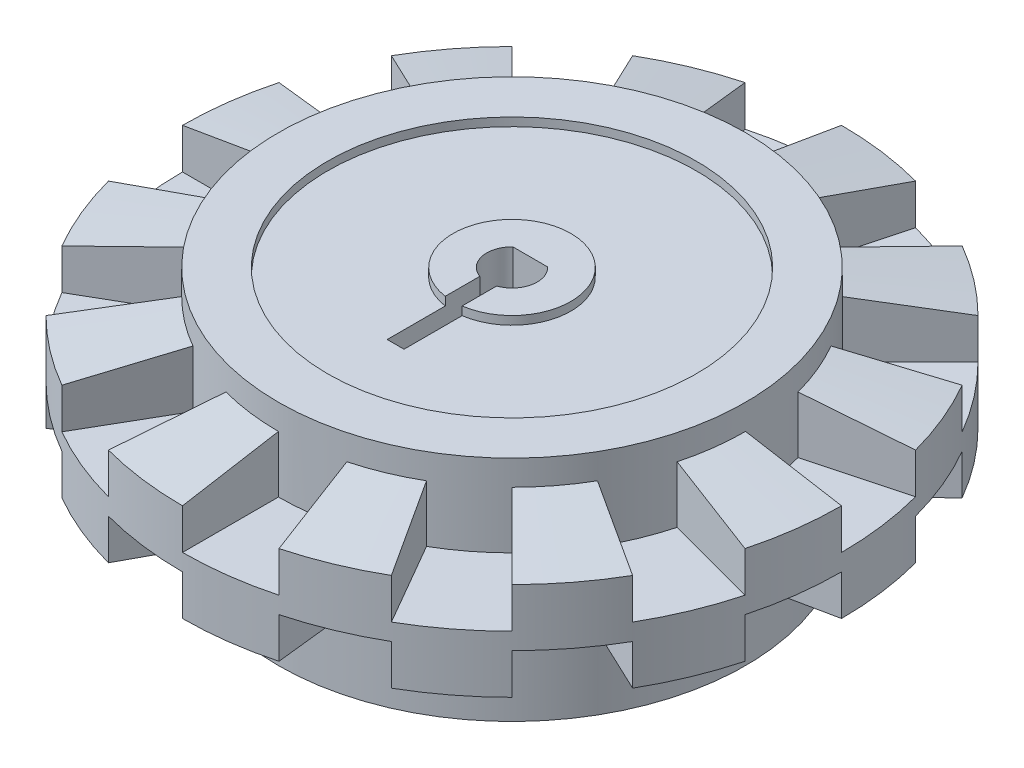
from build123d import *
from build123d.topology import SkipClean

# Parameters (mm, degrees)
CUT_TOPSPOKE_DEPTH   = 10
TOPSPOKES_COUNT      = 12
CUT_BOTSPOKES_DEPTH  = 29.727458554
BOTSPOKES_COUNT      = 12
SHAFT_KEY_DEPTH      = 29.865063225
SHAFT_KEY_DEPTH_BACK = 29.865063225
BOSS_EXTRUDE1_START  = 3.175
BOSS_EXTRUDE1_DEPTH  = 3.175
INNER_SPOKE_START    = -1.4
INNER_SPOKE_DEPTH    = 1.4
INNER_SPOKES_COUNT   = 6


# Read off the part's stored shape, not the designer's step: inner-spoke
with BuildPart() as part:
    # Sketch1 → Revolve1 (revolve)
    with BuildSketch(Plane(origin=(0, 0, 0), x_dir=(0, 0, -1), z_dir=(1, 0, 0)), mode=Mode.PRIVATE) as revolve1_sk:
        Polygon((0, 5.375), (3.5, 5.375), (3.5, 4.875), (10.95, 4.875), (10.95, 5.375), (13.875, 5.375), (13.875, 3.875), (19.575, 2.9), (19.575, -2.9), (13.875, -3.875), (13.875, -8.175), (12.575, -8.175), (12.575, -0.232745207), (12.575, 3.075), (3.5, 3.075), (3.5, -0.5), (0, -0.5), (0, 3.075), align=None)
    revolve(revolve1_sk.sketch.rotate(Axis((0, 13.25798722, 0), (0, -1, 0)), 180), axis=Axis((0, 13.25798722, 0), (0, -1, 0)))

    # Sketch4 → Cut-Topspoke (cut)
    with SkipClean():  # the faces are left unmerged after this step: merging them gives an invalid solid
        with BuildSketch(Plane(origin=(0, 0.5, 0), x_dir=(1, 0, 0), z_dir=(0, 1, 0))):
            with BuildLine():
                Line((0, -13.875), (0, -19.575))
                ThreePointArc((0, -19.575), (2.555050213, -19.407533161), (5.066382808, -18.90799805))
                Line((5.066382808, -18.90799805), (3.591114251, -13.40222084))
                ThreePointArc((3.591114251, -13.40222084), (1.811050917, -13.756297452), (0, -13.875))
            make_face()
        cut_topspoke = extrude(amount=CUT_TOPSPOKE_DEPTH, mode=Mode.SUBTRACT)

    # Topspokes: Cut-Topspoke ×12 about axis
    with SkipClean():  # the faces are left unmerged after this step: merging them gives an invalid solid
        topspokes_axis = Axis((0, 0, 0), (0, 1, 0))
        for i in range(1, TOPSPOKES_COUNT):
            add(cut_topspoke.rotate(topspokes_axis, i * 360 / TOPSPOKES_COUNT), mode=Mode.SUBTRACT)

    # Sketch5 → Cut-Botspokes (cut, through all)
    with SkipClean():  # the faces are left unmerged after this step: merging them gives an invalid solid
        with BuildSketch(Plane(origin=(0, -0.5, 0), x_dir=(1, 0, 0), z_dir=(0, 1, 0))):
            with BuildLine():
                Line((0, 13.875), (0, 19.575))
                ThreePointArc((0, 19.575), (2.555050213, 19.407533161), (5.066382808, 18.90799805))
                Line((5.066382808, 18.90799805), (3.591114251, 13.40222084))
                ThreePointArc((3.591114251, 13.40222084), (1.811050917, 13.756297452), (0, 13.875))
            make_face()
        cut_botspokes = extrude(amount=-CUT_BOTSPOKES_DEPTH, mode=Mode.SUBTRACT)

    # Botspokes: Cut-Botspokes ×12 about axis
    with SkipClean():  # the faces are left unmerged after this step: merging them gives an invalid solid
        botspokes_axis = Axis((0, 0, 0), (0, 1, 0))
        for i in range(1, BOTSPOKES_COUNT):
            add(cut_botspokes.rotate(botspokes_axis, i * 360 / BOTSPOKES_COUNT), mode=Mode.SUBTRACT)

    # Sketch6 → shaft-key (cut, two sides: drawn at the far end of the back side and taken through both)
    with SkipClean():  # the faces are left unmerged after this step: merging them gives an invalid solid
        with BuildSketch(Plane(origin=(0, 0, 0), x_dir=(1, 0, 0), z_dir=(0, 1, 0)).offset(-SHAFT_KEY_DEPTH_BACK)):
            with BuildLine():
                Line((-1.034924061, 1.085786438), (1.034924061, 1.085786438))
                ThreePointArc((1.034924061, 1.085786438), (1.466798544, -0.313850333), (0.5, -1.414213562))
                Line((0.5, -1.414213562), (0.5, -6.914213562))
                Line((0.5, -6.914213562), (-0.5, -6.914213562))
                Line((-0.5, -6.914213562), (-0.5, -1.414213562))
                ThreePointArc((-0.5, -1.414213562), (-1.466798544, -0.313850333), (-1.034924061, 1.085786438))
            make_face()
        extrude(amount=SHAFT_KEY_DEPTH + SHAFT_KEY_DEPTH_BACK, mode=Mode.SUBTRACT)

    # Sketch9 → Boss-Extrude1 (add)
    with SkipClean():  # the faces are left unmerged after this step: merging them gives an invalid solid
        with BuildSketch(Plane.XZ.offset(-3.075).offset(BOSS_EXTRUDE1_START)):
            with BuildLine():
                Line((3.42928564, 0.7), (12.555501782, 0.7))
                ThreePointArc((12.555501782, 0.7), (12.575, 0), (12.555501782, -0.7))
                Line((12.555501782, -0.7), (3.42928564, -0.7))
                ThreePointArc((3.42928564, -0.7), (3.5, 0), (3.42928564, 0.7))
            make_face()
        boss_extrude1 = extrude(amount=-BOSS_EXTRUDE1_DEPTH)

    # inner-spoke outline → inner-spoke (cut)
    with SkipClean():  # the faces are left unmerged after this step: merging them gives an invalid solid
        with BuildSketch(Plane(origin=(0, 0, -0.7), x_dir=(-1, 0, 0), z_dir=(0, 0, -1)).offset(INNER_SPOKE_START)):
            Polygon((-12.555501782, -0.1), (-3.42928564, -0.1), (-3.42928564, 0.5), (-12.555501782, 2.109198138), align=None)
        inner_spoke = extrude(amount=INNER_SPOKE_DEPTH, mode=Mode.SUBTRACT)

    # inner-spokes: Boss-Extrude1, inner-spoke ×6 about axis
    with SkipClean():  # the faces are left unmerged after this step: merging them gives an invalid solid
        inner_spokes_axis = Axis((0, 0, 0), (0, 1, 0))
        add([boss_extrude1.rotate(inner_spokes_axis, i * 360 / INNER_SPOKES_COUNT) for i in range(1, INNER_SPOKES_COUNT)])
        add([inner_spoke.rotate(inner_spokes_axis, i * 360 / INNER_SPOKES_COUNT) for i in range(1, INNER_SPOKES_COUNT)], mode=Mode.SUBTRACT)


solid = part.part
